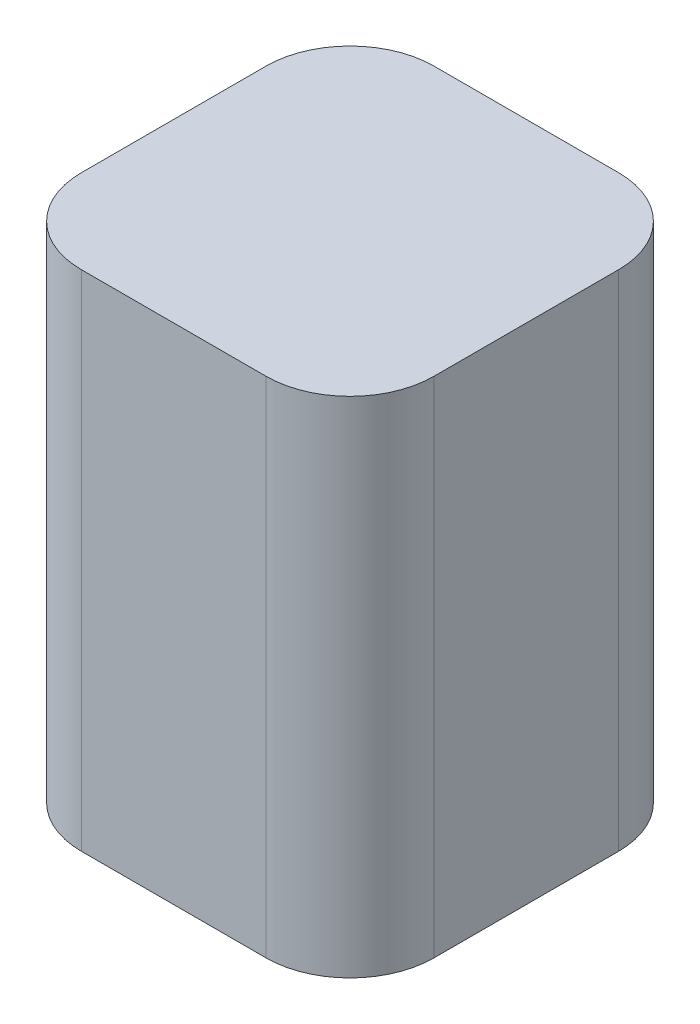
from build123d import *

# Parameters (mm, degrees)
SKETCH1_W           = 42
SKETCH1_H           = 42
BOSS_EXTRUDE1_DEPTH = 60
FILLET1_R           = 10


with BuildPart() as part:
    # Sketch1 → Boss-Extrude1 (new body)
    with BuildSketch(Plane(origin=(0, 0, 0), x_dir=(1, 0, 0), z_dir=(0, 1, 0))):
        Rectangle(SKETCH1_W, SKETCH1_H)
    extrude(amount=BOSS_EXTRUDE1_DEPTH)

    # Fillet1
    fillet1_edges = [part.edges().sort_by_distance(p)[0] for p in [
        (-21, 30, -21),
        (-21, 30, 21),
        (21, 30, -21),
        (21, 30, 21),
    ]]
    fillet(fillet1_edges, radius=FILLET1_R)


solid = part.part
